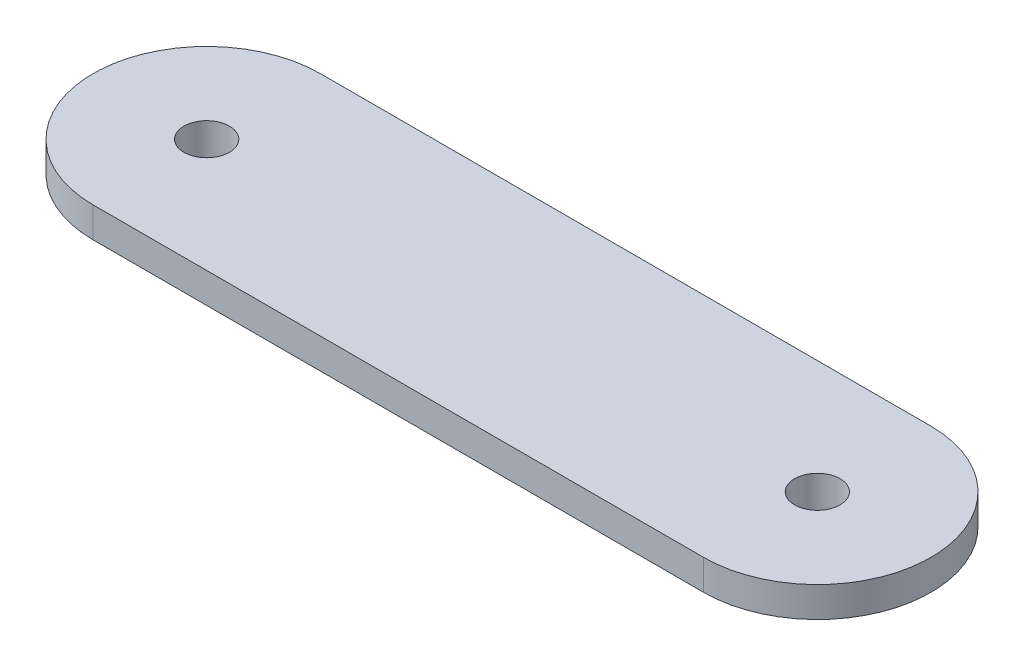
from build123d import *

# Parameters (mm, degrees)
BOSS_EXTRUDE1_DEPTH = 2
SKETCH2_R           = 1.5
CUT_EXTRUDE1_DEPTH  = 29.718852693
BOSS_EXTRUDE2_START = 0.5
SKETCH3_R           = 2
SKETCH3_R_2         = 1.5
BOSS_EXTRUDE2_DEPTH = 0.5
FILLET1_R           = 5


with BuildPart() as part:
    # Sketch1 → Boss-Extrude1 (new body)
    with BuildSketch(Plane(origin=(0, 0, 0), x_dir=(1, 0, 0), z_dir=(0, 1, 0))):
        with BuildLine():
            Line((-20.15, 7.5), (20.15, 7.5))
            ThreePointArc((20.15, 7.5), (27.65, 0), (20.15, -7.5))
            Line((20.15, -7.5), (-20.15, -7.5))
            ThreePointArc((-20.15, -7.5), (-27.65, 0), (-20.15, 7.5))
        make_face()
    extrude(amount=BOSS_EXTRUDE1_DEPTH)

    # Sketch2 → Cut-Extrude1 (cut, through all)
    with BuildSketch(Plane.XZ):
        with Locations(Location((-20.15, 0, 0), (0, 0, 270))):
            Circle(SKETCH2_R)
        with Locations(Location((20.15, 0, 0), (0, 0, 270))):
            Circle(SKETCH2_R)
    extrude(amount=-CUT_EXTRUDE1_DEPTH, mode=Mode.SUBTRACT)

    # Sketch3 → Boss-Extrude2 (add)
    # profile 1 of 2: a face of its own
    with BuildSketch(Plane.XZ.offset(BOSS_EXTRUDE2_START)):
        with Locations(Location((-20.15, 0, 0), (0, 0, 90))):
            Circle(SKETCH3_R)
        with Locations(Location((-20.15, 0, 0), (0, 0, 270))):
            Circle(SKETCH3_R_2, mode=Mode.SUBTRACT)
    # profile 2 of 2: a face of its own
    with BuildSketch(Plane.XZ.offset(BOSS_EXTRUDE2_START)):
        with Locations(Location((20.15, 0, 0), (0, 0, 90))):
            Circle(SKETCH3_R)
        with Locations(Location((20.15, 0, 0), (0, 0, 270))):
            Circle(SKETCH3_R_2, mode=Mode.SUBTRACT)
    extrude(amount=-BOSS_EXTRUDE2_DEPTH)

    # Fillet1
    # the kernel refuses this fillet: 5 mm, written as the material it adds along each edge
    with BuildSketch(Plane(origin=(-20.15, 0, 0), x_dir=(0, 0, 1), z_dir=(1, 0, 0))) as fillet1_piece_1:
        with BuildLine():
            CenterArc((4.179449472, 5), FILLET1_R, 244.158067237, 25.841932763)
            Line((4.179449472, 0), (4.179449472, -0.1))
            Line((4.179449472, -0.1), (2, -0.1))
            Line((2, -0.1), (1.9, 0))
            ThreePointArc((1.9, 0), (1.9, 0.25), (1.956411011, 0.41))
            Line((1.956411011, 0.41), (2, 0.5))
        make_face()
    revolve(axis=Axis((-20.15, 0, 0), (0, -1, 0)))
    with BuildSketch(Plane(origin=(20.15, 0, 0), x_dir=(0, 0, 1), z_dir=(1, 0, 0))) as fillet1_piece_2:
        with BuildLine():
            CenterArc((4.179449472, 5), FILLET1_R, 244.158067237, 25.841932763)
            Line((4.179449472, 0), (4.179449472, -0.1))
            Line((4.179449472, -0.1), (2, -0.1))
            Line((2, -0.1), (1.9, 0))
            ThreePointArc((1.9, 0), (1.9, 0.25), (1.956411011, 0.41))
            Line((1.956411011, 0.41), (2, 0.5))
        make_face()
    revolve(axis=Axis((20.15, 0, 0), (0, -1, 0)))


solid = part.part
